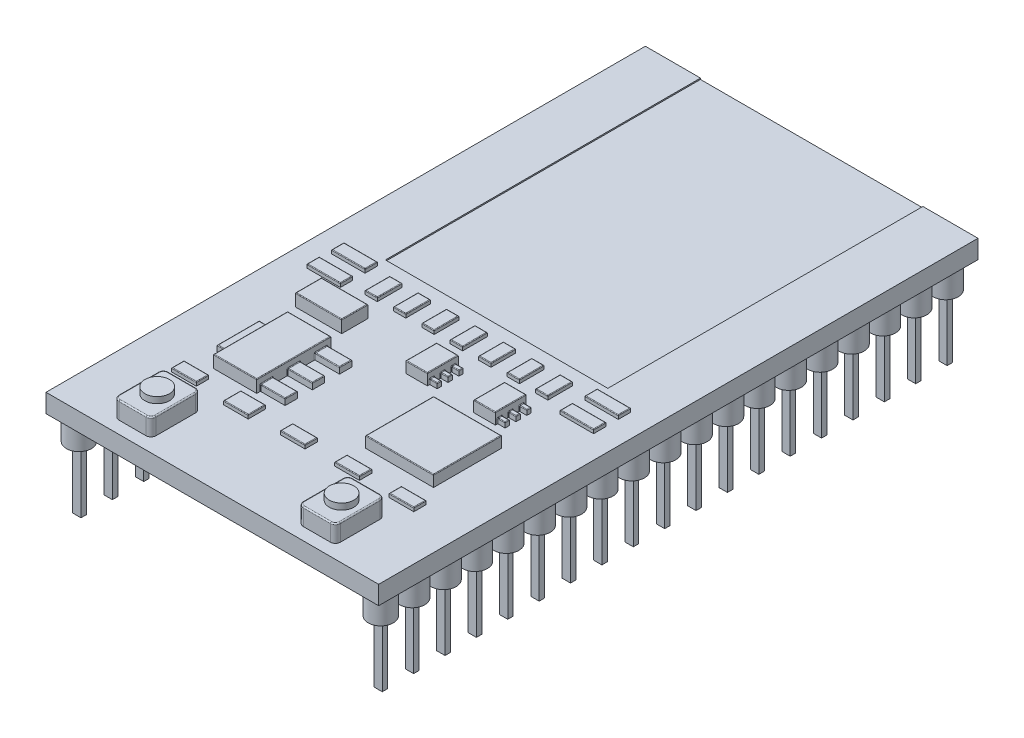
from build123d import *

# Parameters (mm, degrees)
SKETCH1_W                = 26.924
SKETCH1_H                = 48.514
BOSS_EXTRUDE1_DEPTH      = 1.5
BOSS_EXTRUDE5_DEPTH      = 1.4
SKETCH6_R                = 0.995801501
BOSS_EXTRUDE6_DEPTH      = 0.5
SKETCH7_W                = 18
SKETCH7_H                = 25.5
CUT_EXTRUDE1_DEPTH       = 0.1
SKETCH8_W                = 1
SKETCH8_H                = 2
SKETCH8_W_2              = 2
SKETCH8_H_2              = 1
SKETCH8_H_3              = 1.4
SKETCH8_W_3              = 2.709775856
BOSS_EXTRUDE7_DEPTH      = 0.3
SKETCH9_W                = 5.5
SKETCH9_H                = 5.5
SKETCH9_W_2              = 1.75
SKETCH9_H_2              = 2.5
BOSS_EXTRUDE8_DEPTH      = 0.9
SKETCH10_W               = 3.5
SKETCH10_H               = 6
BOSS_EXTRUDE9_DEPTH      = 1
SKETCH11_W               = 2
SKETCH11_H               = 1
SKETCH11_W_2             = 1
SKETCH11_H_2             = 3.4
BOSS_EXTRUDE10_DEPTH     = 0.5
SKETCH12_W               = 0.6
SKETCH12_H               = 0.35
SKETCH12_W_2             = 0.5
SKETCH12_H_2             = 1.41
BOSS_EXTRUDE11_DEPTH     = 0.4
SKETCH13_W               = 3.75
SKETCH13_H               = 2.11
BOSS_EXTRUDE12_DEPTH     = 1
FILLET8_R                = 0.05
FILLET9_R                = 0.05
FILLET10_R               = 0.1
SKETCH23_R               = 1.016
BOSS_EXTRUDE16_DEPTH     = 2.032
SKETCH27_W               = 0.673451717
SKETCH27_H               = 0.440478387
BOSS_EXTRUDE17_DEPTH     = 5.08
LPATTERN1_COUNT          = 19
LPATTERN1_PITCH          = 2.54
MIRROR1_COPY_1_SKETCH_W  = 0.673451717
MIRROR1_COPY_1_SKETCH_H  = 0.440478387
MIRROR1_COPY_1_DEPTH     = 5.08
MIRROR1_COPY_2_SKETCH_W  = 0.673451717
MIRROR1_COPY_2_SKETCH_H  = 0.440478387
MIRROR1_COPY_2_DEPTH     = 5.08
MIRROR1_COPY_3_SKETCH_W  = 0.673451717
MIRROR1_COPY_3_SKETCH_H  = 0.440478387
MIRROR1_COPY_3_DEPTH     = 5.08
MIRROR1_COPY_4_SKETCH_W  = 0.673451717
MIRROR1_COPY_4_SKETCH_H  = 0.440478387
MIRROR1_COPY_4_DEPTH     = 5.08
MIRROR1_COPY_5_SKETCH_W  = 0.673451717
MIRROR1_COPY_5_SKETCH_H  = 0.440478387
MIRROR1_COPY_5_DEPTH     = 5.08
MIRROR1_COPY_6_SKETCH_W  = 0.673451717
MIRROR1_COPY_6_SKETCH_H  = 0.440478387
MIRROR1_COPY_6_DEPTH     = 5.08
MIRROR1_COPY_7_SKETCH_W  = 0.673451717
MIRROR1_COPY_7_SKETCH_H  = 0.440478387
MIRROR1_COPY_7_DEPTH     = 5.08
MIRROR1_COPY_8_SKETCH_W  = 0.673451717
MIRROR1_COPY_8_SKETCH_H  = 0.440478387
MIRROR1_COPY_8_DEPTH     = 5.08
MIRROR1_COPY_9_SKETCH_W  = 0.673451717
MIRROR1_COPY_9_SKETCH_H  = 0.440478387
MIRROR1_COPY_9_DEPTH     = 5.08
MIRROR1_COPY_10_SKETCH_W = 0.673451717
MIRROR1_COPY_10_SKETCH_H = 0.440478387
MIRROR1_COPY_10_DEPTH    = 5.08
MIRROR1_COPY_11_SKETCH_W = 0.673451717
MIRROR1_COPY_11_SKETCH_H = 0.440478387
MIRROR1_COPY_11_DEPTH    = 5.08
MIRROR1_COPY_12_SKETCH_W = 0.673451717
MIRROR1_COPY_12_SKETCH_H = 0.440478387
MIRROR1_COPY_12_DEPTH    = 5.08
MIRROR1_COPY_13_SKETCH_W = 0.673451717
MIRROR1_COPY_13_SKETCH_H = 0.440478387
MIRROR1_COPY_13_DEPTH    = 5.08
MIRROR1_COPY_14_SKETCH_W = 0.673451717
MIRROR1_COPY_14_SKETCH_H = 0.440478387
MIRROR1_COPY_14_DEPTH    = 5.08
MIRROR1_COPY_15_SKETCH_W = 0.673451717
MIRROR1_COPY_15_SKETCH_H = 0.440478387
MIRROR1_COPY_15_DEPTH    = 5.08
MIRROR1_COPY_16_SKETCH_W = 0.673451717
MIRROR1_COPY_16_SKETCH_H = 0.440478387
MIRROR1_COPY_16_DEPTH    = 5.08
MIRROR1_COPY_17_SKETCH_W = 0.673451717
MIRROR1_COPY_17_SKETCH_H = 0.440478387
MIRROR1_COPY_17_DEPTH    = 5.08
MIRROR1_COPY_18_SKETCH_W = 0.673451717
MIRROR1_COPY_18_SKETCH_H = 0.440478387
MIRROR1_COPY_18_DEPTH    = 5.08
MIRROR1_COPY_19_SKETCH_W = 0.673451717
MIRROR1_COPY_19_SKETCH_H = 0.440478387
MIRROR1_COPY_19_DEPTH    = 5.08


with BuildPart() as part:
    # Sketch1 → Boss-Extrude1 (new body)
    with BuildSketch(Plane(origin=(0, 0, 0), x_dir=(1, 0, 0), z_dir=(0, 1, 0))):
        Rectangle(SKETCH1_W, SKETCH1_H)
    extrude(amount=BOSS_EXTRUDE1_DEPTH)

    # Sketch5 → Boss-Extrude5 (add)
    with BuildSketch(Plane(origin=(0, 1.5, 0), x_dir=(1, 0, 0), z_dir=(0, 1, 0))):
        with BuildLine():
            Line((-8.562, -23.257), (-6.362, -23.257))
            ThreePointArc((-6.362, -23.257), (-6.079157288, -23.139842712), (-5.962, -22.857))
            Line((-5.962, -22.857), (-5.962, -19.657))
            ThreePointArc((-5.962, -19.657), (-6.079157288, -19.374157288), (-6.362, -19.257))
            Line((-6.362, -19.257), (-8.562, -19.257))
            ThreePointArc((-8.562, -19.257), (-8.844842712, -19.374157288), (-8.962, -19.657))
            Line((-8.962, -19.657), (-8.962, -22.857))
            ThreePointArc((-8.962, -22.857), (-8.844842712, -23.139842712), (-8.562, -23.257))
        make_face()
        with BuildLine():
            Line((5.962, -22.857), (5.962, -19.657))
            ThreePointArc((5.962, -19.657), (6.079157288, -19.374157288), (6.362, -19.257))
            Line((6.362, -19.257), (8.562, -19.257))
            ThreePointArc((8.562, -19.257), (8.844842712, -19.374157288), (8.962, -19.657))
            Line((8.962, -19.657), (8.962, -22.857))
            ThreePointArc((8.962, -22.857), (8.844842712, -23.139842712), (8.562, -23.257))
            Line((8.562, -23.257), (6.362, -23.257))
            ThreePointArc((6.362, -23.257), (6.079157288, -23.139842712), (5.962, -22.857))
        make_face()
    extrude(amount=BOSS_EXTRUDE5_DEPTH)

    # Sketch6 → Boss-Extrude6 (add)
    with BuildSketch(Plane(origin=(0, 2.9, 0), x_dir=(1, 0, 0), z_dir=(0, 1, 0))):
        with Locations((-7.462, -21.257)):
            Circle(SKETCH6_R)
        with Locations((7.462, -21.257)):
            Circle(SKETCH6_R)
    extrude(amount=BOSS_EXTRUDE6_DEPTH)

    # Sketch7 → Cut-Extrude1 (cut)
    with BuildSketch(Plane(origin=(0, 1.5, 0), x_dir=(1, 0, 0), z_dir=(0, 1, 0))):
        with Locations((0, 11.507)):
            Rectangle(SKETCH7_W, SKETCH7_H)
    extrude(amount=-CUT_EXTRUDE1_DEPTH, mode=Mode.SUBTRACT)

    # Sketch8 → Boss-Extrude7 (add)
    with BuildSketch(Plane(origin=(0, 1.5, 0), x_dir=(1, 0, 0), z_dir=(0, 1, 0))):
        with Locations((2.3, -3.5)):
            Rectangle(SKETCH8_W, SKETCH8_H)
        with Locations((0, -3.5)):
            Rectangle(SKETCH8_W, SKETCH8_H)
        with Locations((0, -17.25)):
            Rectangle(SKETCH8_W_2, SKETCH8_H_2)
        with Locations((-4.4, -17.25)):
            Rectangle(SKETCH8_W_2, SKETCH8_H_3)
        with Locations((-8.8, -17.25)):
            Rectangle(SKETCH8_W_2, SKETCH8_H_2)
        with Locations((4.4, -17.25)):
            Rectangle(SKETCH8_W_2, SKETCH8_H_2)
        with Locations((8.8, -17.25)):
            Rectangle(SKETCH8_W_2, SKETCH8_H_2)
        with Locations((4.6, -3.5)):
            Rectangle(SKETCH8_W, SKETCH8_H)
        with Locations((6.9, -3.5)):
            Rectangle(SKETCH8_W, SKETCH8_H)
        with Locations((-6.9, -3.5)):
            Rectangle(SKETCH8_W, SKETCH8_H)
        with Locations((-4.6, -3.5)):
            Rectangle(SKETCH8_W, SKETCH8_H)
        with Locations((-2.3, -3.5)):
            Rectangle(SKETCH8_W, SKETCH8_H)
        with Locations((10.25, -2.5)):
            Rectangle(SKETCH8_W_3, SKETCH8_H_2)
        with Locations((10.25, -4.5)):
            Rectangle(SKETCH8_W_3, SKETCH8_H_2)
        with Locations((-10.25, -4.5)):
            Rectangle(SKETCH8_W_3, SKETCH8_H_2)
        with Locations((-10.25, -2.5)):
            Rectangle(SKETCH8_W_3, SKETCH8_H_2)
    extrude(amount=BOSS_EXTRUDE7_DEPTH)

    # Sketch9 → Boss-Extrude8 (add)
    with BuildSketch(Plane(origin=(0, 1.5, 0), x_dir=(1, 0, 0), z_dir=(0, 1, 0))):
        with Locations((6.15, -12.5)):
            Rectangle(SKETCH9_W, SKETCH9_H)
        with Locations((0.65, -7.125)):
            Rectangle(SKETCH9_W_2, SKETCH9_H_2)
        with Locations((6.15, -7.125)):
            Rectangle(SKETCH9_W_2, SKETCH9_H_2)
    extrude(amount=BOSS_EXTRUDE8_DEPTH)

    # Sketch10 → Boss-Extrude9 (add)
    with BuildSketch(Plane(origin=(0, 1.5, 0), x_dir=(1, 0, 0), z_dir=(0, 1, 0))):
        with Locations((-6.6, -12.8125)):
            Rectangle(SKETCH10_W, SKETCH10_H)
    extrude(amount=BOSS_EXTRUDE9_DEPTH)

    # Sketch11 → Boss-Extrude10 (add)
    with BuildSketch(Plane(origin=(0, 1.5, 0), x_dir=(1, 0, 0), z_dir=(0, 1, 0))):
        with Locations((-3.85, -12.8125)):
            Rectangle(SKETCH11_W, SKETCH11_H)
        with Locations((-3.85, -10.6125)):
            Rectangle(SKETCH11_W, SKETCH11_H)
        with Locations((-3.85, -15.0125)):
            Rectangle(SKETCH11_W, SKETCH11_H)
        with Locations((-8.85, -12.8125)):
            Rectangle(SKETCH11_W_2, SKETCH11_H_2)
    extrude(amount=BOSS_EXTRUDE10_DEPTH)

    # Sketch12 → Boss-Extrude11 (add)
    with BuildSketch(Plane(origin=(0, 1.5, 0), x_dir=(1, 0, 0), z_dir=(0, 1, 0))):
        with Locations((7.325, -7.13)):
            Rectangle(SKETCH12_W, SKETCH12_H)
        with Locations((7.325, -6.25)):
            Rectangle(SKETCH12_W, SKETCH12_H)
        with Locations((7.325, -8.01)):
            Rectangle(SKETCH12_W, SKETCH12_H)
        with Locations((1.825, -7.13)):
            Rectangle(SKETCH12_W, SKETCH12_H)
        with Locations((1.825, -6.25)):
            Rectangle(SKETCH12_W, SKETCH12_H)
        with Locations((1.825, -8.01)):
            Rectangle(SKETCH12_W, SKETCH12_H)
        with Locations((-0.475, -7.13)):
            Rectangle(SKETCH12_W_2, SKETCH12_H_2)
        with Locations((5.025, -7.13)):
            Rectangle(SKETCH12_W_2, SKETCH12_H_2)
    extrude(amount=BOSS_EXTRUDE11_DEPTH)

    # Sketch13 → Boss-Extrude12 (add)
    with BuildSketch(Plane(origin=(0, 1.5, 0), x_dir=(1, 0, 0), z_dir=(0, 1, 0))):
        with Locations((-7.475, -7.13)):
            Rectangle(SKETCH13_W, SKETCH13_H)
    extrude(amount=BOSS_EXTRUDE12_DEPTH)

    # Fillet8
    fillet8_edges = [part.edges().sort_by_distance(p)[0] for p in [
        (10.25, 1.8, 5),
        (8.895112072, 1.8, 4.5),
        (10.25, 1.8, 4),
        (11.604887928, 1.8, 4.5),
        (10.25, 1.8, 2),
        (11.604887928, 1.8, 2.5),
        (10.25, 1.8, 3),
        (8.895112072, 1.8, 2.5),
        (6.9, 1.8, 2.5),
        (7.4, 1.8, 3.5),
        (6.9, 1.8, 4.5),
        (6.4, 1.8, 3.5),
        (4.6, 1.8, 2.5),
        (5.1, 1.8, 3.5),
        (4.6, 1.8, 4.5),
        (4.1, 1.8, 3.5),
        (2.3, 1.8, 2.5),
        (2.8, 1.8, 3.5),
        (2.3, 1.8, 4.5),
        (1.8, 1.8, 3.5),
        (0, 1.8, 2.5),
        (0.5, 1.8, 3.5),
        (0, 1.8, 4.5),
        (-0.5, 1.8, 3.5),
        (-2.3, 1.8, 2.5),
        (-1.8, 1.8, 3.5),
        (-2.3, 1.8, 4.5),
        (-2.8, 1.8, 3.5),
        (-4.6, 1.8, 2.5),
        (-4.1, 1.8, 3.5),
        (-4.6, 1.8, 4.5),
        (-5.1, 1.8, 3.5),
        (-10.25, 1.8, 4),
        (-8.895112072, 1.8, 4.5),
        (-10.25, 1.8, 5),
        (-11.604887928, 1.8, 4.5),
        (-11.604887928, 1.8, 2.5),
        (-10.25, 1.8, 2),
        (-8.895112072, 1.8, 2.5),
        (-10.25, 1.8, 3),
        (-6.9, 1.8, 2.5),
        (-6.4, 1.8, 3.5),
        (-6.9, 1.8, 4.5),
        (-7.4, 1.8, 3.5),
        (-7.475, 2.5, 6.075),
        (-5.6, 2.5, 7.13),
        (-7.475, 2.5, 8.185),
        (-9.35, 2.5, 7.13),
        (-0.225, 2.4, 7.125),
        (0.65, 2.4, 5.875),
        (1.525, 2.4, 7.125),
        (0.65, 2.4, 8.375),
        (6.15, 2.4, 5.875),
        (7.025, 2.4, 7.125),
        (6.15, 2.4, 8.375),
        (5.275, 2.4, 7.125),
        (-6.6, 2.5, 9.8125),
        (-4.85, 2.5, 12.8125),
        (-6.6, 2.5, 15.8125),
        (-8.35, 2.5, 12.8125),
        (6.15, 2.4, 9.75),
        (8.9, 2.4, 12.5),
        (6.15, 2.4, 15.25),
        (3.4, 2.4, 12.5),
        (-8.8, 1.8, 17.75),
        (-9.8, 1.8, 17.25),
        (-8.8, 1.8, 16.75),
        (-7.8, 1.8, 17.25),
        (-4.4, 1.8, 16.55),
        (-3.4, 1.8, 17.25),
        (-4.4, 1.8, 17.95),
        (-5.4, 1.8, 17.25),
        (0, 1.8, 16.75),
        (1, 1.8, 17.25),
        (0, 1.8, 17.75),
        (-1, 1.8, 17.25),
        (4.4, 1.8, 16.75),
        (5.4, 1.8, 17.25),
        (4.4, 1.8, 17.75),
        (3.4, 1.8, 17.25),
        (8.8, 1.8, 16.75),
        (9.8, 1.8, 17.25),
        (8.8, 1.8, 17.75),
        (7.8, 1.8, 17.25),
    ]]
    fillet(fillet8_edges, radius=FILLET8_R)

    # Fillet9
    fillet9_edges = [part.edges().sort_by_distance(p)[0] for p in [
        (-0.225, 1.7, 7.835),
        (-0.225, 1.7, 6.425),
        (1.525, 1.7, 6.075),
        (1.525, 1.7, 6.425),
        (1.525, 1.7, 6.955),
        (1.525, 1.7, 7.305),
        (1.525, 1.7, 7.835),
        (1.525, 1.7, 8.185),
        (5.275, 1.7, 7.835),
        (5.275, 1.7, 6.425),
        (7.025, 1.7, 6.075),
        (7.025, 1.7, 6.425),
        (7.025, 1.7, 6.955),
        (7.025, 1.7, 7.305),
        (7.025, 1.7, 7.835),
        (7.025, 1.7, 8.185),
        (-4.85, 1.75, 15.5125),
        (-4.85, 1.75, 14.5125),
        (-4.85, 1.75, 11.1125),
        (-4.85, 1.75, 10.1125),
        (-4.85, 1.75, 13.3125),
        (-4.85, 1.75, 12.3125),
        (-8.35, 1.75, 14.5125),
        (-8.35, 1.75, 11.1125),
        (-0.475, 1.9, 7.835),
        (-0.725, 1.9, 7.13),
        (-0.475, 1.9, 6.425),
        (-0.225, 1.9, 7.13),
        (1.825, 1.9, 6.075),
        (2.125, 1.9, 6.25),
        (1.825, 1.9, 6.425),
        (1.525, 1.9, 6.25),
        (1.525, 1.9, 7.13),
        (1.825, 1.9, 6.955),
        (2.125, 1.9, 7.13),
        (1.825, 1.9, 7.305),
        (1.525, 1.9, 8.01),
        (1.825, 1.9, 7.835),
        (2.125, 1.9, 8.01),
        (1.825, 1.9, 8.185),
        (5.025, 1.9, 7.835),
        (4.775, 1.9, 7.13),
        (5.025, 1.9, 6.425),
        (5.275, 1.9, 7.13),
        (7.325, 1.9, 6.075),
        (7.625, 1.9, 6.25),
        (7.325, 1.9, 6.425),
        (7.025, 1.9, 6.25),
        (7.325, 1.9, 6.955),
        (7.625, 1.9, 7.13),
        (7.325, 1.9, 7.305),
        (7.025, 1.9, 7.13),
        (7.325, 1.9, 7.835),
        (7.625, 1.9, 8.01),
        (7.325, 1.9, 8.185),
        (7.025, 1.9, 8.01),
        (-3.85, 2, 15.5125),
        (-4.85, 2, 15.0125),
        (-3.85, 2, 14.5125),
        (-2.85, 2, 15.0125),
        (-3.85, 2, 11.1125),
        (-4.85, 2, 10.6125),
        (-3.85, 2, 10.1125),
        (-2.85, 2, 10.6125),
        (-3.85, 2, 13.3125),
        (-4.85, 2, 12.8125),
        (-3.85, 2, 12.3125),
        (-2.85, 2, 12.8125),
        (-8.85, 2, 14.5125),
        (-9.35, 2, 12.8125),
        (-8.85, 2, 11.1125),
        (-8.35, 2, 12.8125),
    ]]
    fillet(fillet9_edges, radius=FILLET9_R)

    # Fillet10
    fillet10_edges = [part.edges().sort_by_distance(p)[0] for p in [
        (-6.079157288, 2.9, 19.374157288),
        (-5.962, 2.9, 21.257),
        (-6.079157288, 2.9, 23.139842712),
        (-7.462, 2.9, 23.257),
        (-8.844842712, 2.9, 23.139842712),
        (-8.962, 2.9, 21.257),
        (-8.844842712, 2.9, 19.374157288),
        (8.844842712, 2.9, 19.374157288),
        (8.962, 2.9, 21.257),
        (8.844842712, 2.9, 23.139842712),
        (7.462, 2.9, 23.257),
        (6.079157288, 2.9, 23.139842712),
        (5.962, 2.9, 21.257),
        (6.079157288, 2.9, 19.374157288),
        (-7.462, 2.9, 19.257),
        (7.462, 2.9, 19.257),
    ]]
    fillet(fillet10_edges, radius=FILLET10_R)

    # Sketch23 → Boss-Extrude16 (add)
    with BuildSketch(Plane(origin=(0, 0, 0), x_dir=(-1, 0, 0), z_dir=(0, -1, 0))):
        with Locations((12.216808901, -22.834533537)):
            Circle(SKETCH23_R)
        with Locations((12.216808901, -20.294533537)):
            Circle(SKETCH23_R)
        with Locations((12.216808901, -17.754533537)):
            Circle(SKETCH23_R)
        with Locations((12.216808901, -15.214533537)):
            Circle(SKETCH23_R)
        with Locations((12.216808901, -12.674533537)):
            Circle(SKETCH23_R)
        with Locations((12.216808901, -10.134533537)):
            Circle(SKETCH23_R)
        with Locations((12.216808901, -7.594533537)):
            Circle(SKETCH23_R)
        with Locations((12.216808901, -5.054533537)):
            Circle(SKETCH23_R)
        with Locations((12.216808901, -2.514533537)):
            Circle(SKETCH23_R)
        with Locations((12.216808901, 0.025466463)):
            Circle(SKETCH23_R)
        with Locations((12.216808901, 2.565466463)):
            Circle(SKETCH23_R)
        with Locations((12.216808901, 5.105466463)):
            Circle(SKETCH23_R)
        with Locations((12.216808901, 7.645466463)):
            Circle(SKETCH23_R)
        with Locations((12.216808901, 10.185466463)):
            Circle(SKETCH23_R)
        with Locations((12.216808901, 12.725466463)):
            Circle(SKETCH23_R)
        with Locations((12.216808901, 15.265466463)):
            Circle(SKETCH23_R)
        with Locations((12.216808901, 17.805466463)):
            Circle(SKETCH23_R)
        with Locations((12.216808901, 20.345466463)):
            Circle(SKETCH23_R)
        with Locations((12.216808901, 22.885466463)):
            Circle(SKETCH23_R)
        with Locations((-12.216808901, -22.834533537)):
            Circle(SKETCH23_R)
        with Locations((-12.216808901, 17.805466463)):
            Circle(SKETCH23_R)
        with Locations((-12.216808901, 20.345466463)):
            Circle(SKETCH23_R)
        with Locations((-12.216808901, 22.885466463)):
            Circle(SKETCH23_R)
        with Locations((-12.216808901, 15.265466463)):
            Circle(SKETCH23_R)
        with Locations((-12.216808901, 12.725466463)):
            Circle(SKETCH23_R)
        with Locations((-12.216808901, 10.185466463)):
            Circle(SKETCH23_R)
        with Locations((-12.216808901, 7.645466463)):
            Circle(SKETCH23_R)
        with Locations((-12.216808901, 5.105466463)):
            Circle(SKETCH23_R)
        with Locations((-12.216808901, 2.565466463)):
            Circle(SKETCH23_R)
        with Locations((-12.216808901, 0.025466463)):
            Circle(SKETCH23_R)
        with Locations((-12.216808901, -2.514533537)):
            Circle(SKETCH23_R)
        with Locations((-12.216808901, -5.054533537)):
            Circle(SKETCH23_R)
        with Locations((-12.216808901, -7.594533537)):
            Circle(SKETCH23_R)
        with Locations((-12.216808901, -10.134533537)):
            Circle(SKETCH23_R)
        with Locations((-12.216808901, -12.674533537)):
            Circle(SKETCH23_R)
        with Locations((-12.216808901, -15.214533537)):
            Circle(SKETCH23_R)
        with Locations((-12.216808901, -17.754533537)):
            Circle(SKETCH23_R)
        with Locations((-12.216808901, -20.294533537)):
            Circle(SKETCH23_R)
    extrude(amount=BOSS_EXTRUDE16_DEPTH)

    # Sketch27 → Boss-Extrude17 (add)
    with BuildSketch(Plane.XZ.offset(2.032)):
        with Locations((12.192814611, -22.908570921)):
            Rectangle(SKETCH27_W, SKETCH27_H)
    boss_extrude17 = extrude(amount=BOSS_EXTRUDE17_DEPTH)

    # LPattern1: Boss-Extrude17 ×19
    with Locations(*[(0, 0, i * LPATTERN1_PITCH) for i in range(1, LPATTERN1_COUNT)]):
        add(boss_extrude17)

    # Mirror1 copy 1 sketch → Mirror1 copy 1 (add)
    with BuildSketch(Plane(origin=(0, -2.032, 2.54), x_dir=(-1, 0, 0), z_dir=(0, -1, 0))):
        with Locations((12.192814611, 22.908570921)):
            Rectangle(MIRROR1_COPY_1_SKETCH_W, MIRROR1_COPY_1_SKETCH_H)
    extrude(amount=MIRROR1_COPY_1_DEPTH)

    # Mirror1 copy 2 sketch → Mirror1 copy 2 (add)
    with BuildSketch(Plane(origin=(0, -2.032, 5.08), x_dir=(-1, 0, 0), z_dir=(0, -1, 0))):
        with Locations((12.192814611, 22.908570921)):
            Rectangle(MIRROR1_COPY_2_SKETCH_W, MIRROR1_COPY_2_SKETCH_H)
    extrude(amount=MIRROR1_COPY_2_DEPTH)

    # Mirror1 copy 3 sketch → Mirror1 copy 3 (add)
    with BuildSketch(Plane(origin=(0, -2.032, 7.62), x_dir=(-1, 0, 0), z_dir=(0, -1, 0))):
        with Locations((12.192814611, 22.908570921)):
            Rectangle(MIRROR1_COPY_3_SKETCH_W, MIRROR1_COPY_3_SKETCH_H)
    extrude(amount=MIRROR1_COPY_3_DEPTH)

    # Mirror1 copy 4 sketch → Mirror1 copy 4 (add)
    with BuildSketch(Plane(origin=(0, -2.032, 10.16), x_dir=(-1, 0, 0), z_dir=(0, -1, 0))):
        with Locations((12.192814611, 22.908570921)):
            Rectangle(MIRROR1_COPY_4_SKETCH_W, MIRROR1_COPY_4_SKETCH_H)
    extrude(amount=MIRROR1_COPY_4_DEPTH)

    # Mirror1 copy 5 sketch → Mirror1 copy 5 (add)
    with BuildSketch(Plane(origin=(0, -2.032, 12.7), x_dir=(-1, 0, 0), z_dir=(0, -1, 0))):
        with Locations((12.192814611, 22.908570921)):
            Rectangle(MIRROR1_COPY_5_SKETCH_W, MIRROR1_COPY_5_SKETCH_H)
    extrude(amount=MIRROR1_COPY_5_DEPTH)

    # Mirror1 copy 6 sketch → Mirror1 copy 6 (add)
    with BuildSketch(Plane(origin=(0, -2.032, 15.24), x_dir=(-1, 0, 0), z_dir=(0, -1, 0))):
        with Locations((12.192814611, 22.908570921)):
            Rectangle(MIRROR1_COPY_6_SKETCH_W, MIRROR1_COPY_6_SKETCH_H)
    extrude(amount=MIRROR1_COPY_6_DEPTH)

    # Mirror1 copy 7 sketch → Mirror1 copy 7 (add)
    with BuildSketch(Plane(origin=(0, -2.032, 17.78), x_dir=(-1, 0, 0), z_dir=(0, -1, 0))):
        with Locations((12.192814611, 22.908570921)):
            Rectangle(MIRROR1_COPY_7_SKETCH_W, MIRROR1_COPY_7_SKETCH_H)
    extrude(amount=MIRROR1_COPY_7_DEPTH)

    # Mirror1 copy 8 sketch → Mirror1 copy 8 (add)
    with BuildSketch(Plane(origin=(0, -2.032, 20.32), x_dir=(-1, 0, 0), z_dir=(0, -1, 0))):
        with Locations((12.192814611, 22.908570921)):
            Rectangle(MIRROR1_COPY_8_SKETCH_W, MIRROR1_COPY_8_SKETCH_H)
    extrude(amount=MIRROR1_COPY_8_DEPTH)

    # Mirror1 copy 9 sketch → Mirror1 copy 9 (add)
    with BuildSketch(Plane(origin=(0, -2.032, 22.86), x_dir=(-1, 0, 0), z_dir=(0, -1, 0))):
        with Locations((12.192814611, 22.908570921)):
            Rectangle(MIRROR1_COPY_9_SKETCH_W, MIRROR1_COPY_9_SKETCH_H)
    extrude(amount=MIRROR1_COPY_9_DEPTH)

    # Mirror1 copy 10 sketch → Mirror1 copy 10 (add)
    with BuildSketch(Plane(origin=(0, -2.032, 25.4), x_dir=(-1, 0, 0), z_dir=(0, -1, 0))):
        with Locations((12.192814611, 22.908570921)):
            Rectangle(MIRROR1_COPY_10_SKETCH_W, MIRROR1_COPY_10_SKETCH_H)
    extrude(amount=MIRROR1_COPY_10_DEPTH)

    # Mirror1 copy 11 sketch → Mirror1 copy 11 (add)
    with BuildSketch(Plane(origin=(0, -2.032, 27.94), x_dir=(-1, 0, 0), z_dir=(0, -1, 0))):
        with Locations((12.192814611, 22.908570921)):
            Rectangle(MIRROR1_COPY_11_SKETCH_W, MIRROR1_COPY_11_SKETCH_H)
    extrude(amount=MIRROR1_COPY_11_DEPTH)

    # Mirror1 copy 12 sketch → Mirror1 copy 12 (add)
    with BuildSketch(Plane(origin=(0, -2.032, 30.48), x_dir=(-1, 0, 0), z_dir=(0, -1, 0))):
        with Locations((12.192814611, 22.908570921)):
            Rectangle(MIRROR1_COPY_12_SKETCH_W, MIRROR1_COPY_12_SKETCH_H)
    extrude(amount=MIRROR1_COPY_12_DEPTH)

    # Mirror1 copy 13 sketch → Mirror1 copy 13 (add)
    with BuildSketch(Plane(origin=(0, -2.032, 33.02), x_dir=(-1, 0, 0), z_dir=(0, -1, 0))):
        with Locations((12.192814611, 22.908570921)):
            Rectangle(MIRROR1_COPY_13_SKETCH_W, MIRROR1_COPY_13_SKETCH_H)
    extrude(amount=MIRROR1_COPY_13_DEPTH)

    # Mirror1 copy 14 sketch → Mirror1 copy 14 (add)
    with BuildSketch(Plane(origin=(0, -2.032, 35.56), x_dir=(-1, 0, 0), z_dir=(0, -1, 0))):
        with Locations((12.192814611, 22.908570921)):
            Rectangle(MIRROR1_COPY_14_SKETCH_W, MIRROR1_COPY_14_SKETCH_H)
    extrude(amount=MIRROR1_COPY_14_DEPTH)

    # Mirror1 copy 15 sketch → Mirror1 copy 15 (add)
    with BuildSketch(Plane(origin=(0, -2.032, 38.1), x_dir=(-1, 0, 0), z_dir=(0, -1, 0))):
        with Locations((12.192814611, 22.908570921)):
            Rectangle(MIRROR1_COPY_15_SKETCH_W, MIRROR1_COPY_15_SKETCH_H)
    extrude(amount=MIRROR1_COPY_15_DEPTH)

    # Mirror1 copy 16 sketch → Mirror1 copy 16 (add)
    with BuildSketch(Plane(origin=(0, -2.032, 40.64), x_dir=(-1, 0, 0), z_dir=(0, -1, 0))):
        with Locations((12.192814611, 22.908570921)):
            Rectangle(MIRROR1_COPY_16_SKETCH_W, MIRROR1_COPY_16_SKETCH_H)
    extrude(amount=MIRROR1_COPY_16_DEPTH)

    # Mirror1 copy 17 sketch → Mirror1 copy 17 (add)
    with BuildSketch(Plane(origin=(0, -2.032, 43.18), x_dir=(-1, 0, 0), z_dir=(0, -1, 0))):
        with Locations((12.192814611, 22.908570921)):
            Rectangle(MIRROR1_COPY_17_SKETCH_W, MIRROR1_COPY_17_SKETCH_H)
    extrude(amount=MIRROR1_COPY_17_DEPTH)

    # Mirror1 copy 18 sketch → Mirror1 copy 18 (add)
    with BuildSketch(Plane(origin=(0, -2.032, 45.72), x_dir=(-1, 0, 0), z_dir=(0, -1, 0))):
        with Locations((12.192814611, 22.908570921)):
            Rectangle(MIRROR1_COPY_18_SKETCH_W, MIRROR1_COPY_18_SKETCH_H)
    extrude(amount=MIRROR1_COPY_18_DEPTH)

    # Mirror1 copy 19 sketch → Mirror1 copy 19 (add)
    with BuildSketch(Plane(origin=(0, -2.032, 0), x_dir=(-1, 0, 0), z_dir=(0, -1, 0))):
        with Locations((12.192814611, 22.908570921)):
            Rectangle(MIRROR1_COPY_19_SKETCH_W, MIRROR1_COPY_19_SKETCH_H)
    extrude(amount=MIRROR1_COPY_19_DEPTH)


solid = part.part
